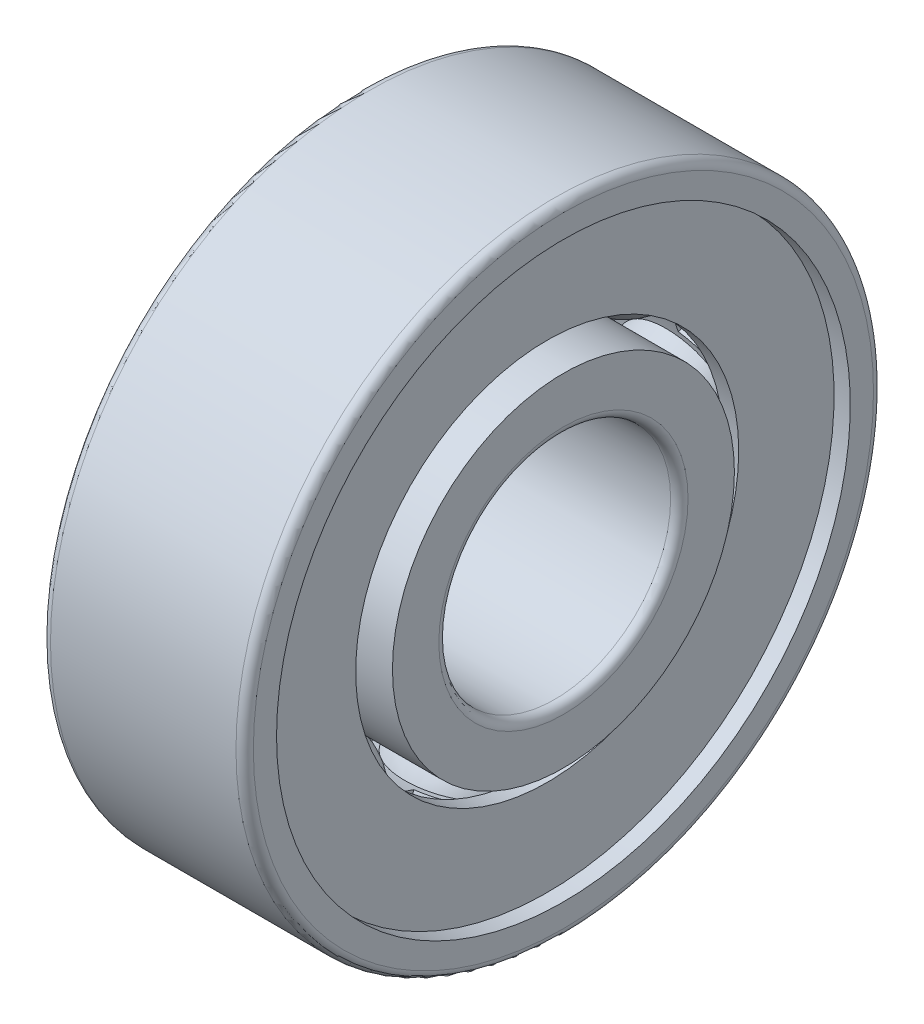
from build123d import *

# Parameters (mm, degrees)
SKETCH_2_W               = 0.946
SKETCH_2_H               = 1.1825
PATTERN_CIRCULAR_1_COUNT = 8
SKETCH_4_W               = 4.73
SKETCH_4_H               = 2.365
SKETCH_5_W               = 4.73
SKETCH_5_H               = 2.365
PATTERN_CIRCULAR_2_COUNT = 8
SKETCH_10_W              = 0.535202389
SKETCH_10_H              = 3.0405
SKETCH_11_R              = 11
CUT_EXTRUDE_1_DEPTH      = 10


with BuildPart() as part:
    # 草图2 → Revolve 389 (revolve)
    with BuildSketch(Plane.XY):
        with Locations((0, 7.9)):
            Rectangle(SKETCH_2_W, SKETCH_2_H)
    revolve(axis=Axis((-12.420610377, 0, 0), (1, 0, 0)))

    # 草图3 → 凸台-旋转1 (revolve)
    with BuildSketch(Plane.XY):
        with BuildLine():
            Line((-2.365, 7.9), (2.365, 7.9))
            ThreePointArc((2.365, 7.9), (0, 5.535), (-2.365, 7.9))
        make_face()
    revolve_1 = revolve(axis=Axis((-5.568093779, 7.9, 0), (1, 0, 0)))

    # 阵列(圆周)1: 凸台-旋转1 ×8 about axis
    pattern_circular_1_axis = Axis((-12.420610377, 0, 0), (1, 0, 0))
    for i in range(1, PATTERN_CIRCULAR_1_COUNT):
        add(revolve_1.rotate(pattern_circular_1_axis, i * 360 / PATTERN_CIRCULAR_1_COUNT))

    # 草图4 → 切除-旋转1 (revolve, cut)
    with BuildSketch(Plane.XY):
        with Locations((0, 9.67375)):
            Rectangle(SKETCH_4_W, SKETCH_4_H)
    revolve(axis=Axis((0, 0, 0), (1, 0, 0)), mode=Mode.SUBTRACT)

    # 草图5 → 切除-旋转2 (revolve, cut)
    with BuildSketch(Plane.XY):
        with Locations((0, 6.12625)):
            Rectangle(SKETCH_5_W, SKETCH_5_H)
    revolve(axis=Axis((0, 0, 0), (1, 0, 0)), mode=Mode.SUBTRACT)

    # 草图6 → 凸台-旋转2 (revolve)
    with BuildSketch(Plane.XY):
        with BuildLine():
            Line((-2.15, 7.9), (2.15, 7.9))
            ThreePointArc((2.15, 7.9), (0, 5.75), (-2.15, 7.9))
        make_face()
    revolve_2 = revolve(axis=Axis((-5.568093779, 7.9, 0), (1, 0, 0)))

    # 阵列(圆周)2: 凸台-旋转2 ×8 about axis
    pattern_circular_2_axis = Axis((-12.420610377, 0, 0), (1, 0, 0))
    for i in range(1, PATTERN_CIRCULAR_2_COUNT):
        add(revolve_2.rotate(pattern_circular_2_axis, i * 360 / PATTERN_CIRCULAR_2_COUNT))

    # 草图7 → 凸台-旋转3 (revolve)
    with BuildSketch(Plane.XY):
        with BuildLine():
            Line((-3.2, 11), (3.2, 11))
            ThreePointArc((3.2, 11), (3.412132034, 10.912132034), (3.5, 10.7))
            Line((3.5, 10.7), (3.5, 9.9))
            Line((3.5, 9.9), (2.94, 9.9))
            Line((2.94, 9.9), (2.94, 9.65))
            Line((2.94, 9.65), (2.404797611, 9.65))
            Line((2.404797611, 9.65), (2.404797611, 9.9))
            Line((2.404797611, 9.9), (0.761314652, 9.9))
            ThreePointArc((0.761314652, 9.9), (0, 10.04), (-0.761314652, 9.9))
            Line((-0.761314652, 9.9), (-3.5, 9.9))
            Line((-3.5, 9.9), (-3.5, 10.7))
            ThreePointArc((-3.5, 10.7), (-3.412132034, 10.912132034), (-3.2, 11))
        make_face()
    revolve(axis=Axis((0, 0, 0), (1, 0, 0)))

    # 草图8 → 凸台-旋转4 (revolve)
    with BuildSketch(Plane.XY):
        with BuildLine():
            Line((-3.5, 5.9), (-0.761314652, 5.9))
            ThreePointArc((-0.761314652, 5.9), (0, 5.76), (0.761314652, 5.9))
            Line((0.761314652, 5.9), (3.5, 5.9))
            Line((3.5, 5.9), (3.5, 4.3))
            ThreePointArc((3.5, 4.3), (3.412132034, 4.087867966), (3.2, 4))
            Line((3.2, 4), (-3.2, 4))
            ThreePointArc((-3.2, 4), (-3.412132034, 4.087867966), (-3.5, 4.3))
            Line((-3.5, 4.3), (-3.5, 5.9))
        make_face()
    revolve(axis=Axis((-12.420610377, 0, 0), (1, 0, 0)))

    # 草图10 → 凸台-旋转5 (revolve)
    with BuildSketch(Plane.XY):
        with Locations((2.672398806, 8.12975)):
            Rectangle(SKETCH_10_W, SKETCH_10_H)
    revolve(axis=Axis((0, 0, 0), (-1, 0, 0)))

    # 草图11 → 切除-拉伸1 (cut)
    with BuildSketch(Plane(origin=(0, 0, 0), x_dir=(0, 0, -1), z_dir=(1, 0, 0))):
        Circle(SKETCH_11_R)
    extrude(amount=-CUT_EXTRUDE_1_DEPTH, mode=Mode.SUBTRACT)

    # 镜向所有1: part across plane


with BuildPart() as part_1:
    add(part.part)
    add(part.part.mirror(Plane(origin=(0, 0, 0), x_dir=(0, 0, 1), z_dir=(1, 0, 0))))


solid = part_1.part
